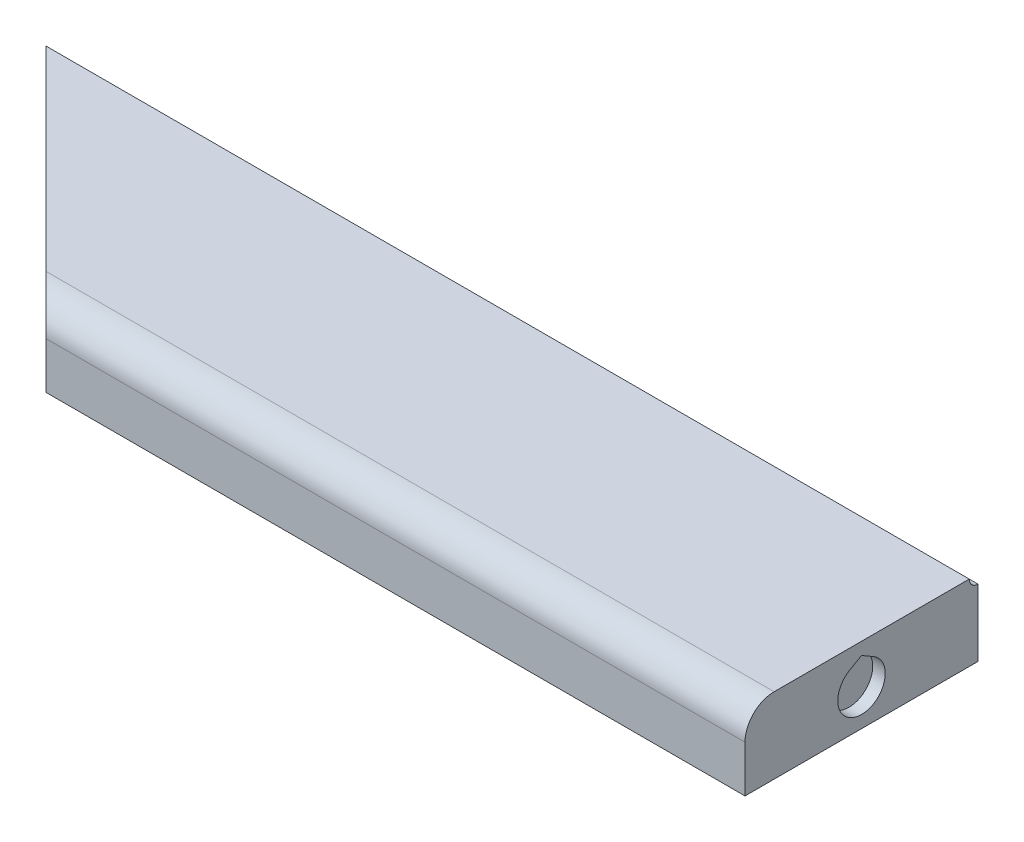
from build123d import *

# Parameters (mm, degrees)
EXTRUDE_1_DEPTH     = 13
SWEEP_START         = -80
SWEEP_1_DEPTH       = 160
SKETCH_6_R          = 4.075
CUT_EXTRUDE_1_DEPTH = 2.15
FILLET_1_R          = 5
SKETCH_7_R          = 4.075
CUT_EXTRUDE_2_DEPTH = 2.15
SKETCH_8_R          = 4.075
CUT_EXTRUDE_3_DEPTH = 2.15


# Read off the part's stored shape, not the designer's step: Вырез-По траектории1
with BuildPart() as part:
    # Эскиз1 → Бобышка-Вытянуть1 (new body)
    with BuildSketch(Plane(origin=(0, 0, 0), x_dir=(1, 0, 0), z_dir=(0, 1, 0))):
        Polygon((-40, -20), (80, -20), (80, 20), (-80, 20), align=None)
    extrude(amount=-EXTRUDE_1_DEPTH)

    # Вырез-По траектории1 outline → Вырез-По траектории1 (cut)
    with BuildSketch(Plane.YZ.offset(SWEEP_START)):
        with BuildLine():
            ThreePointArc((0, -18.5), (-1.060660172, -18.939339828), (-1.5, -20))
            Line((-1.5, -20), (0, -20))
            Line((0, -20), (0, -18.5))
        make_face()
    extrude(amount=SWEEP_1_DEPTH, mode=Mode.SUBTRACT)

    # Эскиз6 → Вырез-Вытянуть1 (cut)
    with BuildSketch(Plane(origin=(0, 0, -20), x_dir=(-1, 0, 0), z_dir=(0, 0, -1))):
        with Locations((-40, -7.565202347)):
            Circle(SKETCH_6_R)
        with BuildLine():
            Line((-40, -2.859797653), (-42.0375, -4.036148827))
            ThreePointArc((-42.0375, -4.036148827), (-40, -3.490202347), (-37.9625, -4.036148827))
            Line((-37.9625, -4.036148827), (-40, -2.859797653))
        make_face()
        with Locations((40, -7.565202347)):
            Circle(SKETCH_6_R)
        with BuildLine():
            ThreePointArc((37.9625, -4.036148827), (40, -3.490202347), (42.0375, -4.036148827))
            Line((42.0375, -4.036148827), (40, -2.859797653))
            Line((40, -2.859797653), (37.9625, -4.036148827))
        make_face()
    extrude(amount=-CUT_EXTRUDE_1_DEPTH, mode=Mode.SUBTRACT)

    # Скругление1
    fillet_1_edges = [part.edges().sort_by_distance(p)[0] for p in [
        (20, 0, 20),
    ]]
    fillet(fillet_1_edges, radius=FILLET_1_R)

    # Эскиз7 → Вырез-Вытянуть2 (cut)
    with BuildSketch(Plane.ZY.offset(-80)):
        with Locations((0, -6.815202347)):
            Circle(SKETCH_7_R)
        with BuildLine():
            Line((2.0375, -3.286148827), (0, -2.109797653))
            Line((0, -2.109797653), (-2.0375, -3.286148827))
            ThreePointArc((-2.0375, -3.286148827), (0, -2.740202347), (2.0375, -3.286148827))
        make_face()
    extrude(amount=CUT_EXTRUDE_2_DEPTH, mode=Mode.SUBTRACT)

    # Эскиз8 → Вырез-Вытянуть3 (cut)
    with BuildSketch(Plane(origin=(-30, 0, 30), x_dir=(0.7071067811865515, 0, 0.7071067811865436), z_dir=(-0.7071067811865436, 0, 0.7071067811865515))):
        with Locations((-42.426406871, -6.815202347)):
            Circle(SKETCH_8_R)
        with BuildLine():
            Line((-42.426406871, -2.109797653), (-44.463906871, -3.286148827))
            ThreePointArc((-44.463906871, -3.286148827), (-42.426406871, -2.740202347), (-40.388906871, -3.286148827))
            Line((-40.388906871, -3.286148827), (-42.426406871, -2.109797653))
        make_face()
    extrude(amount=-CUT_EXTRUDE_3_DEPTH, mode=Mode.SUBTRACT)


solid = part.part
